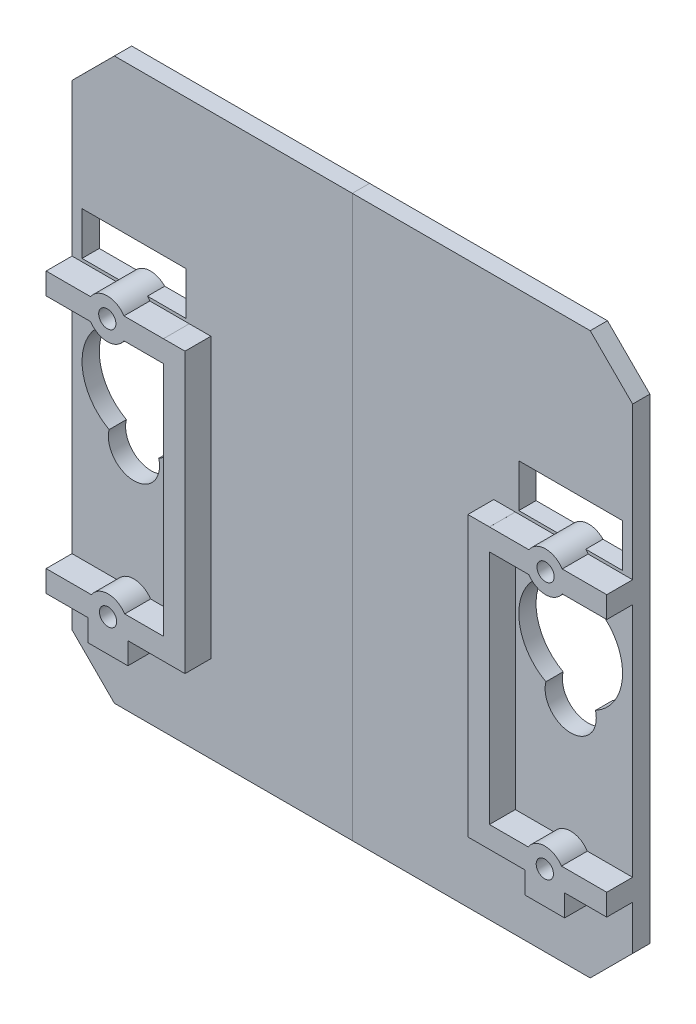
from build123d import *

# Parameters (mm, degrees)
BOSS_EXTRUDE3_DEPTH = 2
SKETCH7_R           = 1
BOSS_EXTRUDE5_DEPTH = 3
SKETCH15_R          = 6.016109345
SKETCH15_R_2        = 2.966709341
CUT_EXTRUDE5_DEPTH  = 3
CUT_EXTRUDE7_START  = -10
CUT_EXTRUDE7_DEPTH  = 10


with BuildPart() as part:
    # Sketch2 → Boss-Extrude3 (new body)
    with BuildSketch(Plane.XY):
        Polygon((62.078732257, 67), (7.070378023, 67), (2.153513577, 62.087886246), (2.153513577, 6.916864445), (7.070378023, 2), (62.078732257, 2), (67.153513577, 7.083274694), (67.153513577, 61.921636784), align=None)
        with BuildLine():
            Line((15.603513577, 44.45), (11.175073004, 44.45))
            ThreePointArc((11.175073004, 44.45), (9.245378023, 45.49849), (7.315683042, 44.45))
            Line((7.315683042, 44.45), (3.053513577, 44.45))
            Line((3.053513577, 44.45), (3.053513577, 49.55))
            Line((3.053513577, 49.55), (15.603513577, 49.55))
            Line((15.603513577, 49.55), (15.603513577, 44.45))
        make_face(mode=Mode.SUBTRACT)
        with BuildLine():
            ThreePointArc((6.384978263, 28.775508397), (6.272687262, 29.080787813), (6.128559615, 29.372390302))
            ThreePointArc((6.128559615, 29.372390302), (9.319946418, 40.479834047), (12.561398281, 29.386897281))
            ThreePointArc((12.561398281, 29.386897281), (12.405099811, 29.087669445), (12.28230409, 28.773205265))
            ThreePointArc((12.28230409, 28.773205265), (9.332354964, 25.48092154), (6.384978263, 28.775508397))
        make_face(mode=Mode.SUBTRACT)
    boss_extrude3 = extrude(amount=BOSS_EXTRUDE3_DEPTH)

    # Sketch7 → Boss-Extrude5 (add)
    with BuildSketch(Plane.XY.offset(2)):
        with BuildLine():
            Line((15.753513577, 14.57), (11.264187035, 14.57))
            ThreePointArc((11.264187035, 14.57), (9.333513577, 15.62), (7.40284012, 14.57))
            Line((7.40284012, 14.57), (2.153513577, 14.57))
            Line((2.153513577, 14.57), (2.153513577, 12.07))
            Line((2.153513577, 12.07), (7.033513577, 12.07))
            Line((7.033513577, 12.07), (7.033513577, 9.547776159))
            Line((7.033513577, 9.547776159), (11.633513577, 9.547776159))
            Line((11.633513577, 9.547776159), (11.633513577, 12.07))
            Line((11.633513577, 12.07), (18.253513577, 12.07))
            Line((18.253513577, 12.07), (18.253513577, 44.45))
            Line((18.253513577, 44.45), (15.753513577, 44.45))
            Line((15.753513577, 44.45), (15.753513577, 44.44849))
            Line((15.753513577, 44.44849), (11.17605148, 44.44849))
            ThreePointArc((11.17605148, 44.44849), (9.245378023, 45.49849), (7.314704565, 44.44849))
            Line((7.314704565, 44.44849), (2.153513577, 44.44849))
            Line((2.153513577, 44.44849), (2.153513577, 41.94849))
            Line((2.153513577, 41.94849), (7.314704565, 41.94849))
            ThreePointArc((7.314704565, 41.94849), (9.245378023, 40.89849), (11.17605148, 41.94849))
            Line((11.17605148, 41.94849), (15.753513577, 41.94849))
            Line((15.753513577, 41.94849), (15.753513577, 14.57))
        make_face()
        with Locations((9.333513577, 13.32)):
            Circle(SKETCH7_R, mode=Mode.SUBTRACT)
        with Locations((9.245378023, 43.19849)):
            Circle(SKETCH7_R, mode=Mode.SUBTRACT)
    boss_extrude5 = extrude(amount=BOSS_EXTRUDE5_DEPTH)

    # Mirror4: Boss-Extrude3, Boss-Extrude5 across plane
    add(boss_extrude3.mirror(Plane.ZY.offset(-34.653513577)))
    add(boss_extrude5.mirror(Plane.ZY.offset(-34.653513577)))

    # Sketch15 → Cut-Extrude5 (cut)
    with BuildSketch(Plane.XY.offset(2)):
        with Locations((9.333513577, 34.46374)):
            Circle(SKETCH15_R)
        with Locations((9.333513577, 28.447630655)):
            Circle(SKETCH15_R_2)
    cut_extrude5 = extrude(amount=-CUT_EXTRUDE5_DEPTH, mode=Mode.SUBTRACT)

    # Mirror5: Cut-Extrude5 across plane
    add(cut_extrude5.mirror(Plane.ZY.offset(-34.653513577)), mode=Mode.SUBTRACT)

    # Sketch29 → Cut-Extrude7 (cut)
    with BuildSketch(Plane.XY.offset(2).offset(CUT_EXTRUDE7_START)):
        with BuildLine():
            Line((3.317404233, 44.795528635), (7.590244313, 44.795528635))
            ThreePointArc((7.590244313, 44.795528635), (9.245378023, 45.49849), (10.900511733, 44.795528635))
            Line((10.900511733, 44.795528635), (15.349622922, 44.795528635))
            Line((15.349622922, 44.795528635), (15.349622922, 49.795528635))
            Line((15.349622922, 49.795528635), (3.317404233, 49.795528635))
            Line((3.317404233, 49.795528635), (3.317404233, 44.795528635))
        make_face()
    cut_extrude7 = extrude(amount=CUT_EXTRUDE7_DEPTH, mode=Mode.SUBTRACT)

    # Mirror9: Cut-Extrude7 across plane
    add(cut_extrude7.mirror(Plane.ZY.offset(-34.653513577)), mode=Mode.SUBTRACT)


with BuildPart() as body_2:
    # Split3: the piece on the far side of the plane
    add(part.part)
    split(bisect_by=Plane(origin=(34.653513577, 0, 0), x_dir=(0, -1, 0), z_dir=(-1, 0, 0)), keep=Keep.BOTTOM)


with BuildPart() as part_1:
    add(part.part)

    # Split3
    split(bisect_by=Plane(origin=(34.653513577, 0, 0), x_dir=(0, -1, 0), z_dir=(-1, 0, 0)), keep=Keep.TOP)


solid = Compound([body_2.part, part_1.part])
